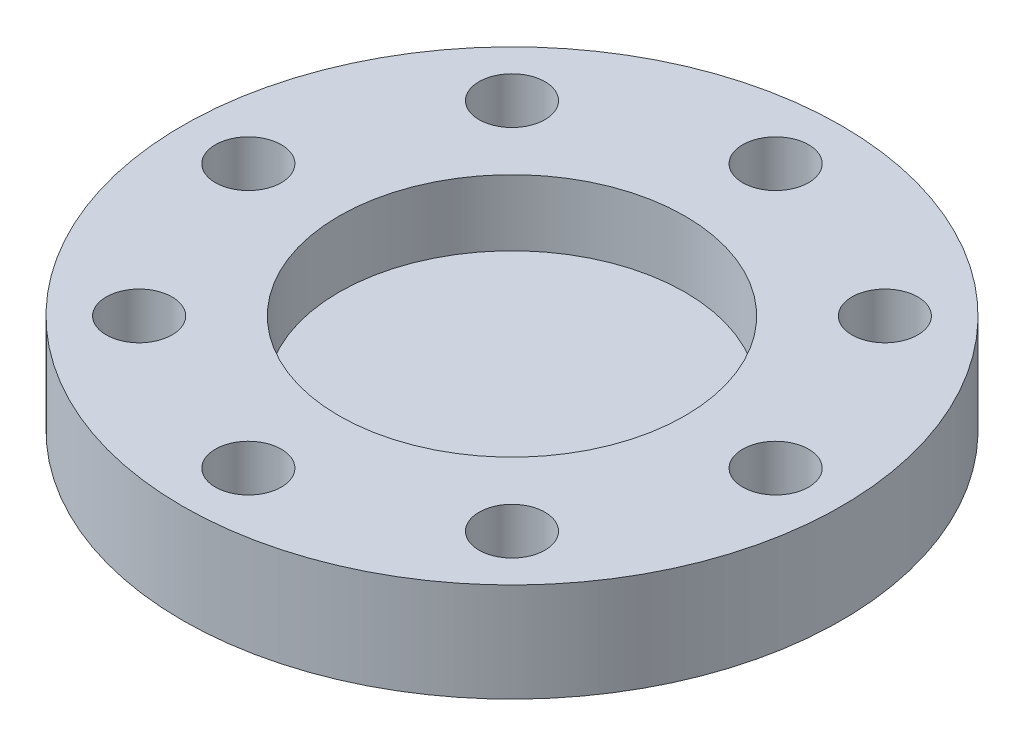
from build123d import *

# Parameters (mm, degrees)
SKETCH_1_R             = 10
SM_BASE_FLANGE_1_DEPTH = 3
SKETCH_6_R             = 5.25
CUT_EXTRUDE_1_DEPTH    = 2
SKETCH_7_R             = 1
CUT_EXTRUDE_2_DEPTH    = 15.456832295


# Sheet-metal steps are written as plain solids
with BuildPart() as part:
    # Sketch 1 → 基体-法兰1 (new body)
    with BuildSketch(Plane(origin=(0, 0, 0), x_dir=(1, 0, 0), z_dir=(0, 1, 0))):
        with Locations(Location((0, 0, 0), (0, 0, 270))):
            Circle(SKETCH_1_R)
    extrude(amount=-SM_BASE_FLANGE_1_DEPTH)

    # 草图6 → 切除-拉伸1 (cut)
    with BuildSketch(Plane(origin=(0, 0, 0), x_dir=(1, 0, 0), z_dir=(0, 1, 0))):
        with Locations(Location((0, 0, 0), (0, 0, 270))):
            Circle(SKETCH_6_R)
    extrude(amount=-CUT_EXTRUDE_1_DEPTH, mode=Mode.SUBTRACT)

    # 草图7 → 切除-拉伸2 (cut, through all)
    with BuildSketch(Plane(origin=(0, 0, 0), x_dir=(1, 0, 0), z_dir=(0, 1, 0))):
        with Locations(Location((0, 8, 0), (0, 0, 270))):
            Circle(SKETCH_7_R)
        with Locations(Location((5.656854249, 5.656854249, 0), (0, 0, 270))):
            Circle(SKETCH_7_R)
        with Locations(Location((8, 0, 0), (0, 0, 270))):
            Circle(SKETCH_7_R)
        with Locations(Location((5.656854249, -5.656854249, 0), (0, 0, 270))):
            Circle(SKETCH_7_R)
        with Locations(Location((0, -8, 0), (0, 0, 270))):
            Circle(SKETCH_7_R)
        with Locations(Location((-5.656854249, -5.656854249, 0), (0, 0, 270))):
            Circle(SKETCH_7_R)
        with Locations(Location((-8, 0, 0), (0, 0, 270))):
            Circle(SKETCH_7_R)
        with Locations(Location((-5.656854249, 5.656854249, 0), (0, 0, 270))):
            Circle(SKETCH_7_R)
    extrude(amount=-CUT_EXTRUDE_2_DEPTH, mode=Mode.SUBTRACT)


solid = part.part
